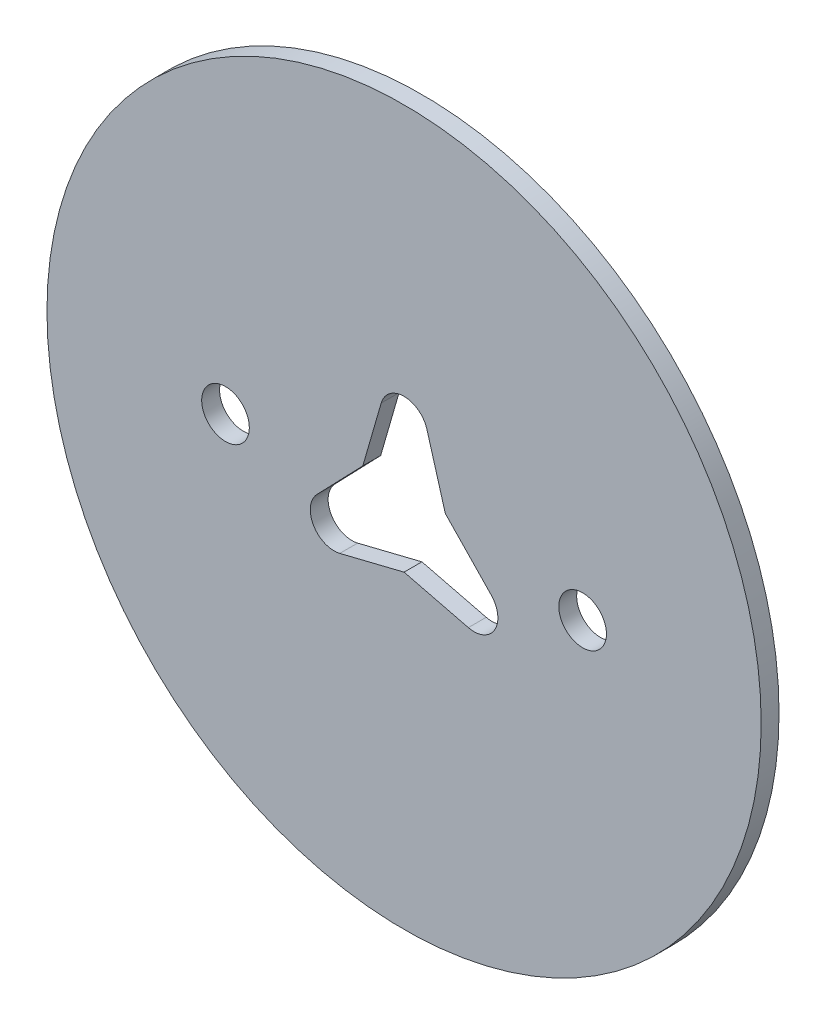
from build123d import *

# Parameters (mm, degrees)
SKETCH1_R           = 30
SKETCH1_R_2         = 2
BOSS_EXTRUDE1_DEPTH = 1.5
CUT_EXTRUDE1_DEPTH  = 10
FILLET1_R           = 2


with BuildPart() as part:
    # Sketch1 → Boss-Extrude1 (new body)
    with BuildSketch(Plane.XY):
        Circle(SKETCH1_R)
        with Locations((15, 0)):
            Circle(SKETCH1_R_2, mode=Mode.SUBTRACT)
        with Locations((-15, 0)):
            Circle(SKETCH1_R_2, mode=Mode.SUBTRACT)
    extrude(amount=BOSS_EXTRUDE1_DEPTH)

    # Sketch2 → Cut-Extrude1 (cut)
    with BuildSketch(Plane(origin=(0, 0, 0), x_dir=(-1, 0, 0), z_dir=(0, 0, -1))):
        Polygon((-3.464101615, 2), (-12.124355653, -7), (0, -4), (12.124355653, -7), (3.464101615, 2), (0, 14), align=None)
    extrude(amount=-CUT_EXTRUDE1_DEPTH, mode=Mode.SUBTRACT)

    # Fillet1
    fillet1_edges = [part.edges().sort_by_distance(p)[0] for p in [
        (12.124355653, -7, 0.75),
        (-12.124355653, -7, 0.75),
        (0, 14, 0.75),
    ]]
    fillet(fillet1_edges, radius=FILLET1_R)


solid = part.part
